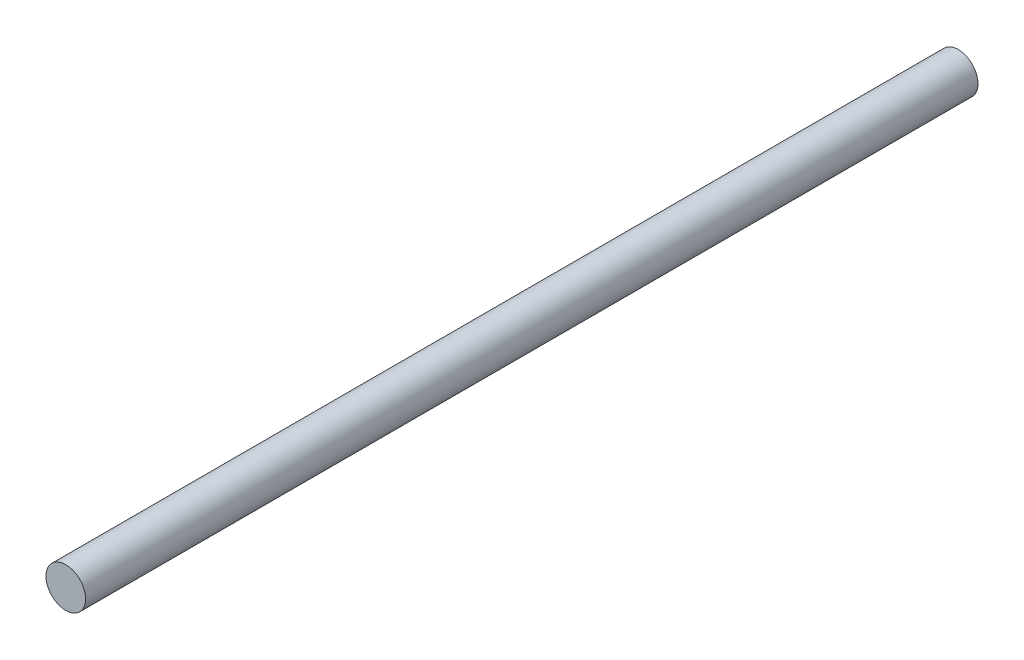
from build123d import *

# Parameters (mm, degrees)
SKETCH1_R           = 6
BOSS_EXTRUDE1_DEPTH = 135


with BuildPart() as part:
    # Sketch1 → Boss-Extrude1 (new, symmetric)
    with BuildSketch(Plane.XY):
        Circle(SKETCH1_R)
    extrude(amount=BOSS_EXTRUDE1_DEPTH, both=True)


solid = part.part
